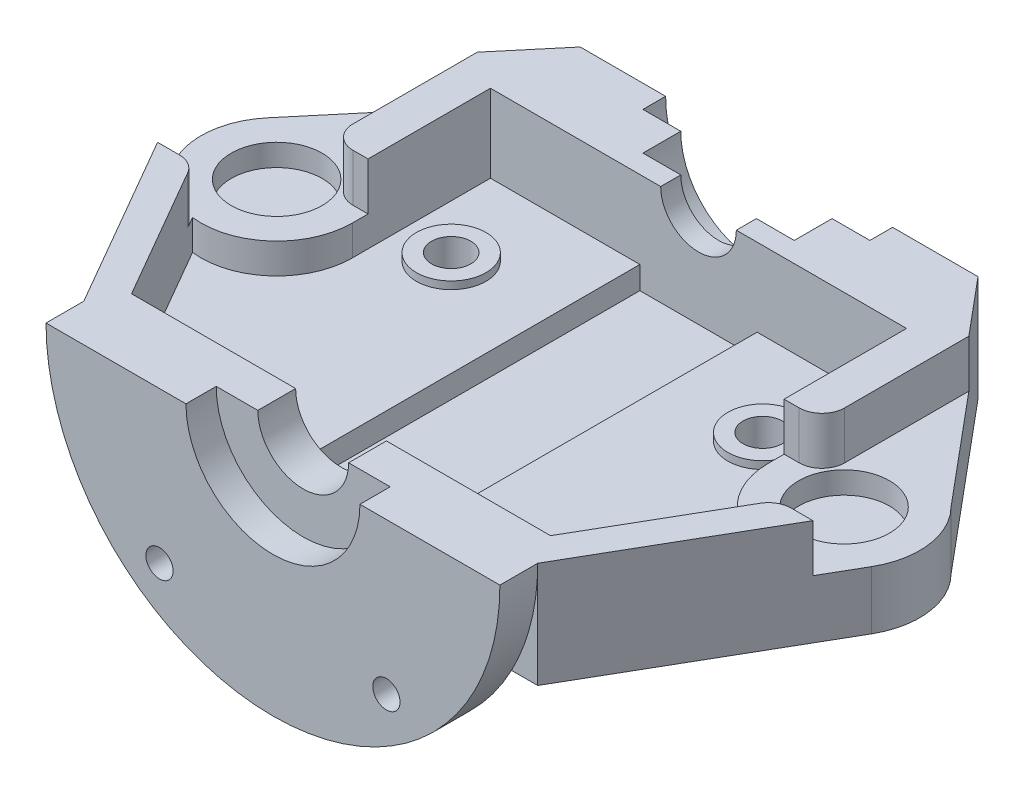
from build123d import *

# Parameters (mm, degrees)
EXTRUDE_1_DEPTH      = 14
CUT_EXTRUDE_START    = -6.3
CUT_EXTRUDE_1_DEPTH  = 6.3
CUT_EXTRUDE_START_2  = -3
CUT_EXTRUDE_2_DEPTH  = 3
SKETCH_4_R           = 6.01
CUT_EXTRUDE_3_DEPTH  = 2.9
CUT_EXTRUDE_4_REACH  = 109.588
SKETCH_5_R           = 2.6
CUT_EXTRUDE_START_3  = -1
SKETCH_6_R           = 4.6
CUT_EXTRUDE_6_DEPTH  = 1
EXTRUDE_2_DEPTH      = 5
SKETCH_8_R           = 11.5
CUT_EXTRUDE_7_DEPTH  = 4
CUT_EXTRUDE_8_REACH  = 110.373
SKETCH_9_R           = 1.8
FILLET_1_R           = 3
SKETCH_12_R          = 10
CUT_EXTRUDE_10_DEPTH = 8
EXTRUDE_3_DEPTH      = 61.90646084
SKETCH_19_R          = 6
CUT_EXTRUDE_14_DEPTH = 9
CUT_EXTRUDE_11_REACH = 108.687
SKETCH_13_R          = 5
SKETCH_21_R          = 15
CUT_EXTRUDE_15_DEPTH = 3
SKETCH_23_R          = 1.5
CUT_EXTRUDE_16_DEPTH = 7
CUT_EXTRUDE_START_4  = -5
CUT_EXTRUDE_19_DEPTH = 5
SKETCH_34_W          = 15.5
SKETCH_34_H          = 47.251878887
CUT_EXTRUDE_20_DEPTH = 3


with BuildPart() as part:
    # 草图1 → 凸台-拉伸1 (new body)
    with BuildSketch(Plane(origin=(0, 0, 0), x_dir=(1, 0, 0), z_dir=(0, 1, 0))):
        with BuildLine():
            Line((13.709398988, 61.90646084), (-5.160444431, 39.418257154))
            ThreePointArc((-5.160444431, 39.418257154), (-7.461946981, 33.861938484), (-6.160254038, 27.990381057))
            Line((-6.160254038, 27.990381057), (10, 0))
            Line((10, 0), (70, 0))
            Line((70, 0), (86.160254038, 27.990381057))
            ThreePointArc((86.160254038, 27.990381057), (87.414448614, 34.295642979), (84.571067812, 40.061448869))
            Line((84.571067812, 40.061448869), (66.290601012, 61.90646084))
            Line((66.290601012, 61.90646084), (13.709398988, 61.90646084))
        make_face()
    extrude(amount=EXTRUDE_1_DEPTH)

    # 草图2 → 切除-拉伸1 (cut)
    with BuildSketch(Plane(origin=(0, 14, 0), x_dir=(1, 0, 0), z_dir=(0, 1, 0)).offset(CUT_EXTRUDE_START)):
        with BuildLine():
            Line((-3.314954576, 23.062177826), (1.303847577, 23.062177826))
            Line((1.303847577, 23.062177826), (12.309401077, 4))
            Line((12.309401077, 4), (67.690598923, 4))
            Line((67.690598923, 4), (78.696152423, 23.062177826))
            Line((78.696152423, 23.062177826), (83.314954576, 23.062177826))
            Line((83.314954576, 23.062177826), (86.160254038, 27.990381057))
            ThreePointArc((86.160254038, 27.990381057), (87.461946981, 33.861938484), (85.160444431, 39.418257154))
            ThreePointArc((85.160444431, 39.418257154), (84.872773368, 39.746283133), (84.571067812, 40.061448869))
            Line((84.571067812, 40.061448869), (73.343672408, 53.478096796))
            Line((73.343672408, 53.478096796), (72.5, 54.486278592))
            Line((72.5, 54.486278592), (72.5, 35.067052168))
            Line((72.5, 35.067052168), (67.5, 35.067052168))
            Line((67.5, 35.067052168), (67.5, 46.251878887))
            Line((67.5, 46.251878887), (12.5, 46.251878887))
            Line((12.5, 46.251878887), (12.5, 35.067052168))
            Line((12.5, 35.067052168), (7.5, 35.067052168))
            Line((7.5, 35.067052168), (7.5, 54.506387288))
            Line((7.5, 54.506387288), (-5.160444431, 39.418257154))
            ThreePointArc((-5.160444431, 39.418257154), (-7.461946981, 33.861938484), (-6.160254038, 27.990381057))
            Line((-6.160254038, 27.990381057), (-3.314954576, 23.062177826))
        make_face()
    extrude(amount=CUT_EXTRUDE_1_DEPTH, mode=Mode.SUBTRACT)

    # 草图3 → 切除-拉伸2 (cut)
    with BuildSketch(Plane(origin=(0, 7.7, 0), x_dir=(1, 0, 0), z_dir=(0, 1, 0)).offset(CUT_EXTRUDE_START_2)):
        with BuildLine():
            Line((67.690598923, 4), (78.696152423, 23.062177826))
            ThreePointArc((78.696152423, 23.062177826), (70.865300468, 25.508351779), (67.5, 32.990381057))
            Line((67.5, 32.990381057), (67.5, 35.067052168))
            Line((67.5, 35.067052168), (67.5, 46.251878887))
            Line((67.5, 46.251878887), (12.5, 46.251878887))
            Line((12.5, 46.251878887), (12.5, 35.067052168))
            Line((12.5, 35.067052168), (12.5, 32.990381057))
            ThreePointArc((12.5, 32.990381057), (9.134699532, 25.508351779), (1.303847577, 23.062177826))
            Line((1.303847577, 23.062177826), (12.309401077, 4))
            Line((12.309401077, 4), (67.690598923, 4))
        make_face()
    extrude(amount=CUT_EXTRUDE_2_DEPTH, mode=Mode.SUBTRACT)

    # 草图4 → 切除-拉伸3 (cut)
    with BuildSketch(Plane(origin=(0, 7.7, 0), x_dir=(1, 0, 0), z_dir=(0, 1, 0))):
        with Locations(Location((2.5, 32.990381057, 0), (0, 0, 270))):
            Circle(SKETCH_4_R)
        with Locations(Location((77.5, 32.990381057, 0), (0, 0, 270))):
            Circle(SKETCH_4_R)
    extrude(amount=-CUT_EXTRUDE_3_DEPTH, mode=Mode.SUBTRACT)

    # 草图5 → 切除-拉伸4 (cut, up to next)
    with BuildSketch(Plane(origin=(0, 4.7, 0), x_dir=(1, 0, 0), z_dir=(0, 1, 0)), mode=Mode.PRIVATE) as cut_extrude_4_sk1:
        with Locations(Location((19.414467174, 39.146743637, 0), (0, 0, 270))):
            Circle(SKETCH_5_R)
    cut_extrude_4_tool1 = extrude(cut_extrude_4_sk1.sketch, amount=-CUT_EXTRUDE_4_REACH, mode=Mode.PRIVATE) & part.part
    # 草图5 → 切除-拉伸4 (cut, up to next)
    with BuildSketch(Plane(origin=(0, 4.7, 0), x_dir=(1, 0, 0), z_dir=(0, 1, 0)), mode=Mode.PRIVATE) as cut_extrude_4_sk2:
        with Locations(Location((60.585532826, 39.146743637, 0), (0, 0, 270))):
            Circle(SKETCH_5_R)
    cut_extrude_4_tool2 = extrude(cut_extrude_4_sk2.sketch, amount=-CUT_EXTRUDE_4_REACH, mode=Mode.PRIVATE) & part.part
    add(cut_extrude_4_tool1.solids().sort_by_distance((19.414467, 4.7, -39.146744))[0], mode=Mode.SUBTRACT)
    add(cut_extrude_4_tool2.solids().sort_by_distance((60.585533, 4.7, -39.146744))[0], mode=Mode.SUBTRACT)

    # 草图6 → 切除-拉伸6 (cut)
    with BuildSketch(Plane(origin=(0, 4.7, 0), x_dir=(1, 0, 0), z_dir=(0, 1, 0)).offset(CUT_EXTRUDE_START_3)):
        with BuildLine():
            Line((67.690598923, 4), (78.696152423, 23.062177826))
            ThreePointArc((78.696152423, 23.062177826), (70.865300468, 25.508351779), (67.5, 32.990381057))
            Line((67.5, 32.990381057), (67.5, 46.251878887))
            Line((67.5, 46.251878887), (12.5, 46.251878887))
            Line((12.5, 46.251878887), (12.5, 32.990381057))
            ThreePointArc((12.5, 32.990381057), (9.134699532, 25.508351779), (1.303847577, 23.062177826))
            Line((1.303847577, 23.062177826), (12.309401077, 4))
            Line((12.309401077, 4), (67.690598923, 4))
        make_face()
        with Locations(Location((19.414467174, 39.146743637, 0), (0, 0, 270))):
            Circle(SKETCH_6_R, mode=Mode.SUBTRACT)
        with Locations(Location((60.585532826, 39.146743637, 0), (0, 0, 270))):
            Circle(SKETCH_6_R, mode=Mode.SUBTRACT)
    extrude(amount=CUT_EXTRUDE_6_DEPTH, mode=Mode.SUBTRACT)

    # 草图7 → 凸台-拉伸2 (add)
    with BuildSketch(Plane.XY):
        with BuildLine():
            Line((10, 14), (70, 14))
            ThreePointArc((70, 14), (40, -16), (10, 14))
        make_face()
    extrude(amount=EXTRUDE_2_DEPTH)

    # 草图8 → 切除-拉伸7 (cut)
    with BuildSketch(Plane.XY.offset(5)):
        with Locations((40, 14)):
            Circle(SKETCH_8_R)
    extrude(amount=-CUT_EXTRUDE_7_DEPTH, mode=Mode.SUBTRACT)

    # 草图9 → 切除-拉伸8 (cut, up to next)
    with BuildSketch(Plane(origin=(0, 0, 0), x_dir=(-1, 0, 0), z_dir=(0, 0, -1)), mode=Mode.PRIVATE) as cut_extrude_8_sk1:
        with Locations((-55, -6)):
            Circle(SKETCH_9_R)
    cut_extrude_8_tool1 = extrude(cut_extrude_8_sk1.sketch, amount=-CUT_EXTRUDE_8_REACH, mode=Mode.PRIVATE) & part.part
    # 草图9 → 切除-拉伸8 (cut, up to next)
    with BuildSketch(Plane(origin=(0, 0, 0), x_dir=(-1, 0, 0), z_dir=(0, 0, -1)), mode=Mode.PRIVATE) as cut_extrude_8_sk2:
        with Locations((-25, -6)):
            Circle(SKETCH_9_R)
    cut_extrude_8_tool2 = extrude(cut_extrude_8_sk2.sketch, amount=-CUT_EXTRUDE_8_REACH, mode=Mode.PRIVATE) & part.part
    add(cut_extrude_8_tool1.solids().sort_by_distance((55, -6, 0))[0], mode=Mode.SUBTRACT)
    add(cut_extrude_8_tool2.solids().sort_by_distance((25, -6, 0))[0], mode=Mode.SUBTRACT)

    # 圆角1
    # the kernel refuses this fillet: 3 mm, written as the material it takes off along each edge
    with BuildSketch(Plane(origin=(78.696152423, 7.7, -23.062177826), x_dir=(1, 0, 0), z_dir=(0, 1, 0))) as fillet_1_piece_1:
        with BuildLine():
            CenterArc((FILLET_1_R * 0.57735026919, -FILLET_1_R), FILLET_1_R, 90, 60)
            Line((-FILLET_1_R * 0.288675134595, -FILLET_1_R * 0.5), (0, 0))
            Line((0, 0), (FILLET_1_R * 0.57735026919, 0))
        make_face()
    extrude(amount=10.630127019, mode=Mode.SUBTRACT)
    with BuildSketch(Plane(origin=(1.303847577, 7.7, -23.062177826), x_dir=(-1, 0, 0), z_dir=(0, 1, 0))) as fillet_1_piece_2:
        with BuildLine():
            CenterArc((FILLET_1_R * 0.57735026919, FILLET_1_R), FILLET_1_R, 210, 60)
            Line((-FILLET_1_R * 0.288675134595, FILLET_1_R * 0.5), (0, 0))
            Line((0, 0), (FILLET_1_R * 0.57735026919, 0))
        make_face()
    extrude(amount=10.630127019, mode=Mode.SUBTRACT)
    with BuildSketch(Plane(origin=(7.5, 7.7, -35.067052168), x_dir=(0, 0, -1), z_dir=(0, 1, 0))) as fillet_1_piece_3:
        with BuildLine():
            CenterArc((FILLET_1_R, -FILLET_1_R), FILLET_1_R, 90, 90)
            Line((0, -FILLET_1_R), (0, 0))
            Line((0, 0), (FILLET_1_R, 0))
        make_face()
    extrude(amount=13.8, mode=Mode.SUBTRACT)
    with BuildSketch(Plane(origin=(72.5, 7.7, -35.067052168), x_dir=(0, 0, -1), z_dir=(0, 1, 0))) as fillet_1_piece_4:
        with BuildLine():
            CenterArc((FILLET_1_R, FILLET_1_R), FILLET_1_R, 180, 90)
            Line((0, FILLET_1_R), (0, 0))
            Line((0, 0), (FILLET_1_R, 0))
        make_face()
    extrude(amount=13.8, mode=Mode.SUBTRACT)

    # 草图12 → 切除-拉伸10 (cut)
    with BuildSketch(Plane(origin=(0, 0, -61.90646084), x_dir=(-1, 0, 0), z_dir=(0, 0, -1))):
        with Locations((-40, 14)):
            Circle(SKETCH_12_R)
    extrude(amount=-CUT_EXTRUDE_10_DEPTH, mode=Mode.SUBTRACT)

    # 草图16 → 凸台-拉伸3 (add)
    with BuildSketch(Plane(origin=(0, 0, -61.90646084), x_dir=(-1, 0, 0), z_dir=(0, 0, -1))):
        with BuildLine():
            ThreePointArc((-50.5, 0), (-40, -3.5), (-29.5, 0))
            Line((-29.5, 0), (-50.5, 0))
        make_face()
    extrude(amount=-EXTRUDE_3_DEPTH)

    # 草图19 → 切除-拉伸14 (cut)
    with BuildSketch(Plane.XY.offset(5)):
        with Locations((40, 14)):
            Circle(SKETCH_19_R)
    extrude(amount=-CUT_EXTRUDE_14_DEPTH, mode=Mode.SUBTRACT)

    # 草图13 → 切除-拉伸11 (cut, up to next)
    with BuildSketch(Plane(origin=(0, 0, -53.90646084), x_dir=(-1, 0, 0), z_dir=(0, 0, -1)), mode=Mode.PRIVATE) as cut_extrude_11_sk1:
        with Locations((-40, 14)):
            Circle(SKETCH_13_R)
    cut_extrude_11_tool1 = extrude(cut_extrude_11_sk1.sketch, amount=-CUT_EXTRUDE_11_REACH, mode=Mode.PRIVATE) & part.part
    add(cut_extrude_11_tool1.solids().sort_by_distance((40, 14, -53.906461))[0], mode=Mode.SUBTRACT)

    # 草图21 → 切除-拉伸15 (cut)
    with BuildSketch(Plane(origin=(0, 0, -61.90646084), x_dir=(-1, 0, 0), z_dir=(0, 0, -1))):
        with Locations((-40, 14)):
            Circle(SKETCH_21_R)
    extrude(amount=-CUT_EXTRUDE_15_DEPTH, mode=Mode.SUBTRACT)

    # 草图23 → 切除-拉伸16 (cut)
    with BuildSketch(Plane(origin=(0, 0, -58.90646084), x_dir=(-1, 0, 0), z_dir=(0, 0, -1))):
        with Locations((-50.356157589, 7)):
            Circle(SKETCH_23_R)
        with Locations((-29.643842411, 7)):
            Circle(SKETCH_23_R)
    extrude(amount=-CUT_EXTRUDE_16_DEPTH, mode=Mode.SUBTRACT)

    # 草图33 → 切除-拉伸19 (cut)
    with BuildSketch(Plane.XY.offset(-46.251878887).offset(CUT_EXTRUDE_START_4)):
        with BuildLine():
            Line((35, 14), (12.5, 14))
            Line((12.5, 14), (12.5, 3.7))
            Line((12.5, 3.7), (67.5, 3.7))
            Line((67.5, 3.7), (67.5, 14))
            Line((67.5, 14), (45, 14))
            ThreePointArc((45, 14), (40, 9), (35, 14))
        make_face()
    extrude(amount=CUT_EXTRUDE_19_DEPTH, mode=Mode.SUBTRACT)

    # 草图34 → 切除-拉伸20 (cut)
    with BuildSketch(Plane(origin=(0, 3.7, 0), x_dir=(1, 0, 0), z_dir=(0, 1, 0))):
        with Locations((40, 27.625939444)):
            Rectangle(SKETCH_34_W, SKETCH_34_H)
    extrude(amount=-CUT_EXTRUDE_20_DEPTH, mode=Mode.SUBTRACT)


solid = part.part
